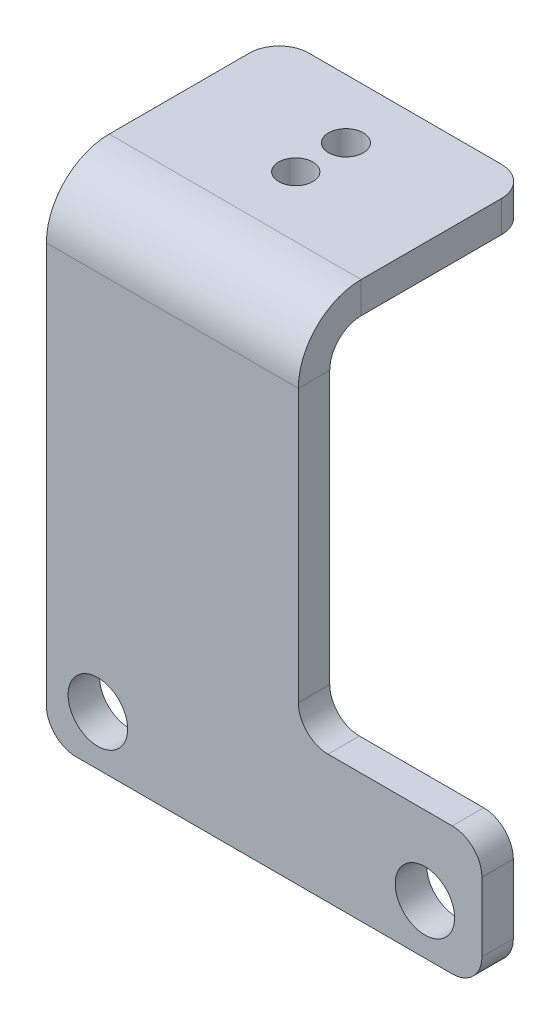
from build123d import *

# Parameters (mm, degrees)
SKETCH1_W                    = 44.01968481
SKETCH1_H                    = 69.878571894
BOSS_EXTRUDE1_DEPTH          = 3.175
SKETCH3_W                    = 18.555037993
SKETCH3_H                    = 36.867111451
CUT_EXTRUDE1_DEPTH           = 3.175
EDGE_FLANGE1_STRIP_W         = 19.05
EDGE_FLANGE1_STRIP_H         = 3.175
EDGE_FLANGE1_STRIP_CUT_DEPTH = 25.464646817
EDGE_FLANGE1_DEPTH           = 25.464646817
SKETCH22_W                   = 44.01968481
SKETCH22_H                   = 20.04943399
CUT_EXTRUDE2_DEPTH           = 3.175
FILLET1_R                    = 3
SKETCH23_R                   = 3.008539127
SKETCH23_R_2                 = 3
CUT_EXTRUDE3_DEPTH           = 3.175
SKETCH24_R                   = 1.724090174
SKETCH24_R_2                 = 1.754985839
CUT_EXTRUDE4_DEPTH           = 3.175


# Sheet-metal steps are written as plain solids
with BuildPart() as part:
    # Sketch1 → Boss-Extrude1 (new body)
    with BuildSketch(Plane.XY):
        Rectangle(SKETCH1_W, SKETCH1_H)
    extrude(amount=BOSS_EXTRUDE1_DEPTH)

    # Sketch3 → Cut-Extrude1 (cut)
    with BuildSketch(Plane.XY.offset(3.175)):
        with Locations((12.732323409, 16.505730222)):
            Rectangle(SKETCH3_W, SKETCH3_H)
    extrude(amount=-CUT_EXTRUDE1_DEPTH, mode=Mode.SUBTRACT)

    # Edge-Flange1 strip (across the edge) → Edge-Flange1 strip cut (cut)
    with BuildSketch(Plane(origin=(-22.009842405, 34.939285947, 0), x_dir=(0, -1, 0), z_dir=(1, 0, 0))):
        with Locations((-3.175, -1.5875)):
            Rectangle(EDGE_FLANGE1_STRIP_W, EDGE_FLANGE1_STRIP_H)
    extrude(amount=EDGE_FLANGE1_STRIP_CUT_DEPTH, mode=Mode.SUBTRACT)

    # Edge-Flange1 section (across the edge) → Edge-Flange1 (add)
    with BuildSketch(Plane(origin=(-22.009842405, 34.939285947, 0), x_dir=(0, -1, 0), z_dir=(1, 0, 0))):
        with BuildLine():
            Line((0, 3.175), (0, 20.35))
            Line((0, 20.35), (3.175, 20.35))
            Line((3.175, 20.35), (3.175, 3.175))
            ThreePointArc((3.175, 3.175), (4.10493597, 0.92993597), (6.35, 0))
            Line((6.35, 0), (6.35, -3.175))
            ThreePointArc((6.35, -3.175), (1.859871939, -1.315128061), (0, 3.175))
        make_face()
    extrude(amount=EDGE_FLANGE1_DEPTH)

    # Sketch22 → Cut-Extrude2 (cut)
    with BuildSketch(Plane.XY.offset(3.175)):
        with Locations((0, -24.914568952)):
            Rectangle(SKETCH22_W, SKETCH22_H)
    extrude(amount=-CUT_EXTRUDE2_DEPTH, mode=Mode.SUBTRACT)

    # Fillet1
    fillet1_edges = [part.edges().sort_by_distance(p)[0] for p in [
        (22.009842405, -1.927825504, 1.5875),
        (3.454804412, -1.927825504, 1.5875),
        (-22.009842405, 33.351785947, -20.35),
        (3.454804412, 33.351785947, -20.35),
        (-22.009842405, -14.889851957, 1.5875),
        (22.009842405, -14.889851957, 1.5875),
    ]]
    fillet(fillet1_edges, radius=FILLET1_R)

    # Sketch23 → Cut-Extrude3 (cut)
    with BuildSketch(Plane.XY.offset(3.175)):
        with Locations((-16.805425884, -9.867122138)):
            Circle(SKETCH23_R)
        with Locations((16.248443226, -9.867122138)):
            Circle(SKETCH23_R_2)
    extrude(amount=-CUT_EXTRUDE3_DEPTH, mode=Mode.SUBTRACT)

    # Sketch24 → Cut-Extrude4 (cut)
    with BuildSketch(Plane(origin=(0, 34.939285947, 0), x_dir=(1, 0, 0), z_dir=(0, 1, 0))):
        with Locations(Location((-9.277518997, 9.296029356, 0), (0, 0, 270))):
            Circle(SKETCH24_R)
        with Locations(Location((-9.277518997, 14.371964171, 0), (0, 0, 270))):
            Circle(SKETCH24_R_2)
    extrude(amount=-CUT_EXTRUDE4_DEPTH, mode=Mode.SUBTRACT)


solid = part.part
